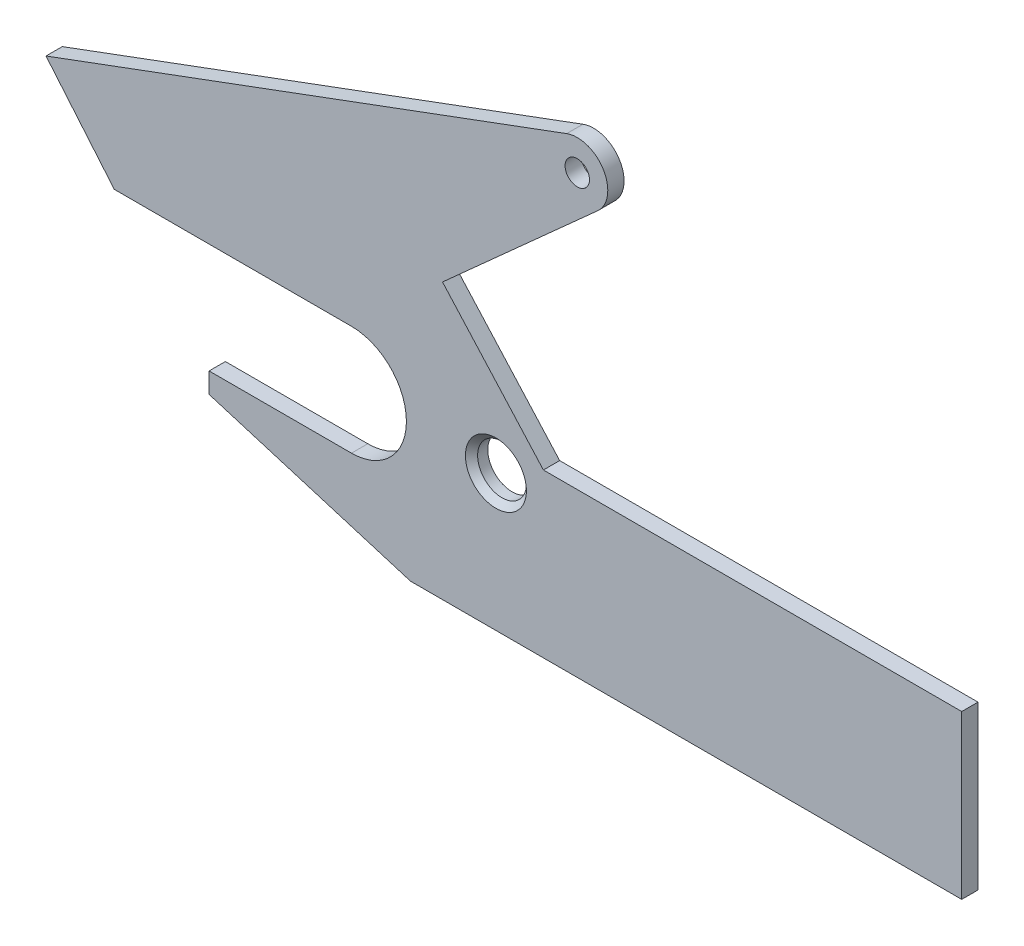
from build123d import *

# Parameters (mm, degrees)
SKETCH_1_R             = 3
SKETCH_1_R_2           = 6
SM_BASE_FLANGE_1_DEPTH = 4
CHAMFER_2_SIZE         = 1.5


# Sheet-metal steps are written as plain solids
with BuildPart() as part:
    # Sketch 1 → Базовая кромка1 (new body)
    with BuildSketch(Plane.XY):
        with BuildLine():
            Line((60.509861789, 68.353533944), (22.375898858, 34.12410114))
            Line((22.375898858, 34.12410114), (47.171572875, 6.5))
            Line((47.171572875, 6.5), (150, 6.5))
            Line((150, 6.5), (150, -33.5))
            Line((150, -33.5), (14.5, -33.5))
            Line((14.5, -33.5), (-35, -18.5))
            Line((-35, -18.5), (-35, -13.5))
            Line((-35, -13.5), (0, -13.5))
            ThreePointArc((0, -13.5), (13.5, 0), (0, 13.5))
            Line((0, 13.5), (-58.308631084, 13.5))
            Line((-58.308631084, 13.5), (-75.090623708, 33.5))
            Line((-75.090623708, 33.5), (52.891961096, 80.966804205))
            ThreePointArc((52.891961096, 80.966804205), (61.919955994, 77.812259079), (60.509861789, 68.353533944))
        make_face()
        with Locations((55.5, 73.934867553)):
            Circle(SKETCH_1_R, mode=Mode.SUBTRACT)
        with Locations((35.5, 0)):
            Circle(SKETCH_1_R_2, mode=Mode.SUBTRACT)
    extrude(amount=SM_BASE_FLANGE_1_DEPTH)

    # Фаска2
    chamfer_2_edges = [part.edges().sort_by_distance(p)[0] for p in [
        (29.5, 0, 4),
    ]]
    chamfer(chamfer_2_edges, length=CHAMFER_2_SIZE)


solid = part.part
